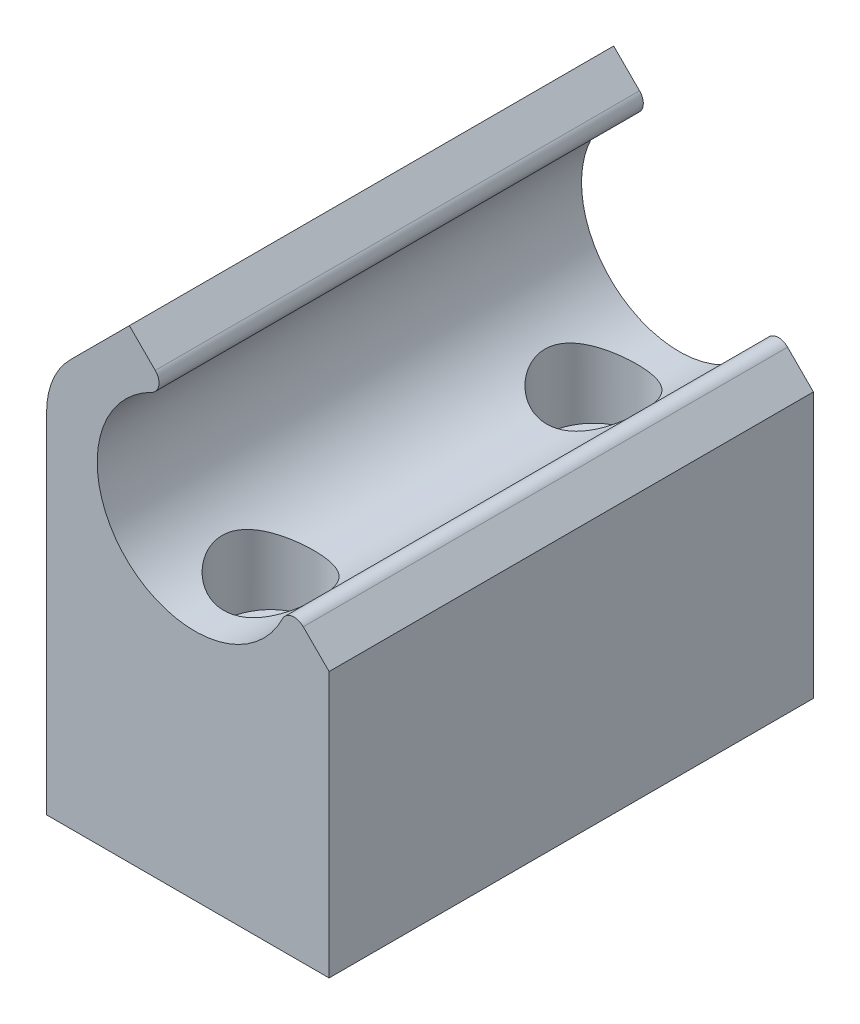
from build123d import *

# Parameters (mm, degrees)
BOSS_EXTRUDE1_DEPTH = 30
FILLET1_R           = 0.8
SKETCH3_R           = 3
CUT_EXTRUDE1_DEPTH  = 7
SKETCH4_R           = 1.55
CUT_EXTRUDE2_DEPTH  = 40.0397494
FILLET2_R           = 5


with BuildPart() as part:
    # Sketch1 → Boss-Extrude1 (new body)
    with BuildSketch(Plane.XY):
        with BuildLine():
            Line((0, 0), (17.5, 0))
            Line((17.5, 0), (17.5, 16.44))
            Line((17.5, 16.44), (15.025126266, 18.914873734))
            ThreePointArc((15.025126266, 18.914873734), (4.907782078, 16.219443047), (7.603212766, 26.336787234))
            Line((7.603212766, 26.336787234), (5.128339032, 28.811660968))
            Line((5.128339032, 28.811660968), (0, 23.683321936))
            Line((0, 23.683321936), (0, 0))
        make_face()
    extrude(amount=BOSS_EXTRUDE1_DEPTH)

    # Fillet1
    fillet1_edges = [part.edges().sort_by_distance(p)[0] for p in [
        (15.025126266, 18.914873734, 15),
        (7.603212766, 26.336787234, 15),
    ]]
    fillet(fillet1_edges, radius=FILLET1_R)

    # Sketch3 → Cut-Extrude1 (cut)
    with BuildSketch(Plane(origin=(0, 17.828405067, 0), x_dir=(-1, 0, 0), z_dir=(0, -1, 0))):
        with Locations((-8.875495285, -5)):
            Circle(SKETCH3_R)
        with Locations((-8.875495285, -25)):
            Circle(SKETCH3_R)
    extrude(amount=CUT_EXTRUDE1_DEPTH, mode=Mode.SUBTRACT)

    # Sketch4 → Cut-Extrude2 (cut, through all)
    with BuildSketch(Plane(origin=(0, 17.828405067, 0), x_dir=(-1, 0, 0), z_dir=(0, -1, 0))):
        with Locations((-8.875495285, -5)):
            Circle(SKETCH4_R)
        with Locations((-8.875495285, -25)):
            Circle(SKETCH4_R)
    extrude(amount=CUT_EXTRUDE2_DEPTH, mode=Mode.SUBTRACT)

    # Fillet2
    fillet2_edges = [part.edges().sort_by_distance(p)[0] for p in [
        (0, 23.683321936, 15),
    ]]
    fillet(fillet2_edges, radius=FILLET2_R)


solid = part.part
